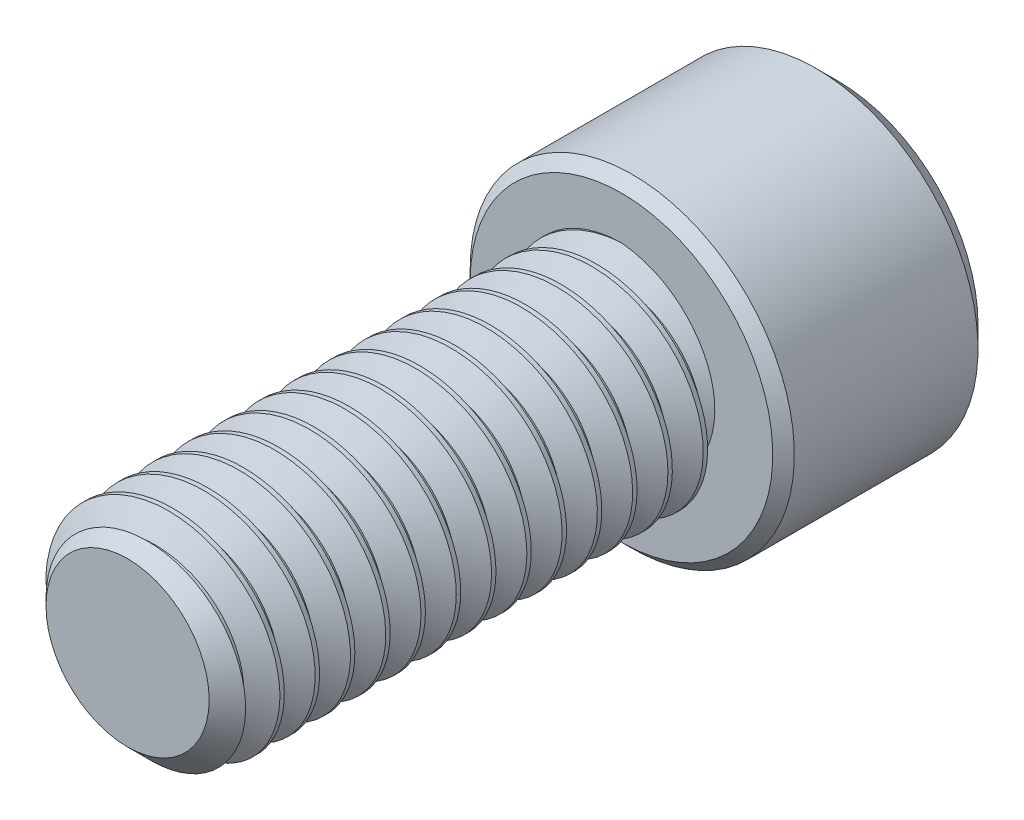
from build123d import *

# Parameters (mm, degrees)
SKETCH1_R          = 5.55625
EXTRUDE1_DEPTH     = 25.4
CHAMFER3_SIZE      = 1.360714286
CUT_SWEEP1_PITCH   = 1.814285714
SKETCH6_R          = 8.334375
EXTRUDE2_DEPTH     = 11.1125
CUT_EXTRUDE1_DEPTH = 7.14375
SKETCH8_R          = 5.499261314
CUT_EXTRUDE2_DEPTH = 1.11125
CUT_EXTRUDE2_DRAFT = -45
CHAMFER1_SIZE      = 1.11125
CHAMFER2_SIZE      = 0.555625


with BuildPart() as part:
    # Sketch1 → Extrude1 (new body)
    with BuildSketch(Plane.XY):
        Circle(SKETCH1_R)
    extrude(amount=-EXTRUDE1_DEPTH)

    # Chamfer3
    chamfer3_edges = [part.edges().sort_by_distance(p)[0] for p in [
        (-5.55625, 0, 0),
    ]]
    chamfer(chamfer3_edges, length=CHAMFER3_SIZE)

    # Cut-Sweep1: the profile of Sketch3 profile screwed along a right-hand helix of 15 turns, 6 arcs to a turn; built about Z, then put on its axis
    cut_sweep1_z = Axis((0, 0, 0), (0, 0, 1))
    cut_sweep1_corners = [(5.55655, 0, -1.587673205), (4.377836861, 0, -0.907142857), (4.377836861, 0, -0.680357143), (5.55655, 0, 0.000173205)]
    with BuildLine(mode=Mode.PRIVATE) as cut_sweep1_profile:
        Line(cut_sweep1_corners[0], cut_sweep1_corners[1])
        Line(cut_sweep1_corners[1], cut_sweep1_corners[2])
        Line(cut_sweep1_corners[2], cut_sweep1_corners[3])
        Line(cut_sweep1_corners[3], cut_sweep1_corners[0])
    cut_sweep1_cap = Face(cut_sweep1_profile.wire())
    cut_sweep1_turn_angles = [0, 30, 60, 90, 120, 150, 180, 210, 240, 270, 300, 330, 360]
    cut_sweep1_turn_weights = [1, 0.8660254037844387, 1, 0.8660254037844387, 1, 0.8660254037844387, 1, 0.8660254037844387, 1, 0.8660254037844387, 1, 0.8660254037844387, 1]
    cut_sweep1_turn_rails = [Edge.make_bspline([Vector(p[0], p[1], 0).rotate(cut_sweep1_z, cut_sweep1_turn_angles[k]) / cut_sweep1_turn_weights[k] + Vector(0, 0, p[2] + CUT_SWEEP1_PITCH * cut_sweep1_turn_angles[k] / 360) for k in range(13)], [0, 0, 0, 1, 1, 2, 2, 3, 3, 4, 4, 5, 5, 6, 6, 6], 2, cut_sweep1_turn_weights) for p in cut_sweep1_corners]
    cut_sweep1_turn_sides = [Face.make_surface_from_curves(cut_sweep1_turn_rails[p[0]], cut_sweep1_turn_rails[p[1]]) for p in [(0, 1), (1, 2), (2, 3), (3, 0)]]
    cut_sweep1_turn = Solid(Shell([*cut_sweep1_turn_sides, cut_sweep1_cap, cut_sweep1_cap.rotate(cut_sweep1_z, 360).moved(Location((0, 0, CUT_SWEEP1_PITCH * 360 / 360)))]))
    cut_sweep1_each = [*[cut_sweep1_turn.moved(Location((0, 0, CUT_SWEEP1_PITCH * i))) for i in range(15)]]
    add(Plane(origin=(0, 0, 0), x_dir=(0, 1, 0), z_dir=(0, 0, -1)) * Compound([cut_sweep1_each[i] for i in range(0, 15, 2)]), mode=Mode.SUBTRACT)
    add(Plane(origin=(0, 0, 0), x_dir=(0, 1, 0), z_dir=(0, 0, -1)) * Compound([cut_sweep1_each[i] for i in range(1, 15, 2)]), mode=Mode.SUBTRACT)

    # Sketch6 → Extrude2 (add)
    with BuildSketch(Plane(origin=(0, 0, -25.4), x_dir=(-1, 0, 0), z_dir=(0, 0, -1))):
        Circle(SKETCH6_R)
    extrude(amount=EXTRUDE2_DEPTH)

    # Sketch7 → Cut-Extrude1 (cut)
    with BuildSketch(Plane(origin=(0, 0, -36.5125), x_dir=(-1, 0, 0), z_dir=(0, 0, -1))):
        Polygon((0, 5.499261314), (-4.7625, 2.749630657), (-4.7625, -2.749630657), (0, -5.499261314), (4.7625, -2.749630657), (4.7625, 2.749630657), align=None)
    extrude(amount=-CUT_EXTRUDE1_DEPTH, mode=Mode.SUBTRACT)


with BuildPart() as cut_extrude2_tool:
    # Sketch8 → Cut-Extrude2 (with draft: the straight prism first)
    with BuildSketch(Plane(origin=(0, 0, -36.5125), x_dir=(-1, 0, 0), z_dir=(0, 0, -1))):
        Circle(SKETCH8_R)
    extrude(amount=-CUT_EXTRUDE2_DEPTH)
    # Cut-Extrude2: the draft: its side faces are tilted about the plane it starts from
    cut_extrude2_sides = [cut_extrude2_tool.faces().sort_by_distance(p)[0] for p in [
        (5.499261314, 0, -35.956875),
    ]]
    draft(cut_extrude2_sides, Plane(origin=(0, 0, -36.5125), x_dir=(-1, 0, 0), z_dir=(0, 0, -1)), CUT_EXTRUDE2_DRAFT)


with BuildPart() as part_1:
    add(part.part)

    # Cut-Extrude2: cut by cut_extrude2_tool
    add(cut_extrude2_tool.part, mode=Mode.SUBTRACT)

    # Chamfer1
    chamfer1_edges = [part_1.edges().sort_by_distance(p)[0] for p in [
        (8.334375, 0, -36.5125),
    ]]
    chamfer(chamfer1_edges, length=CHAMFER1_SIZE)

    # Chamfer2
    chamfer2_edges = [part_1.edges().sort_by_distance(p)[0] for p in [
        (8.334375, 0, -25.4),
    ]]
    chamfer(chamfer2_edges, length=CHAMFER2_SIZE)


solid = part_1.part
